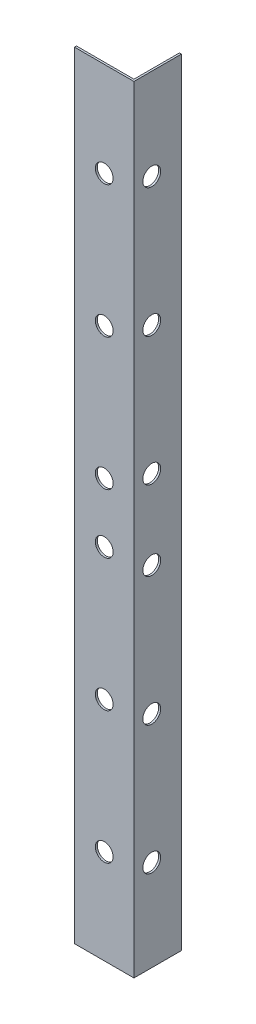
from build123d import *

# Parameters (mm, degrees)
BOSS_EXTRUDE1_DEPTH = 196
CUT_EXTRUDE4_REACH  = 198.939
SKETCH5_R           = 2.25
CUT_EXTRUDE5_REACH  = 198.939
SKETCH6_R           = 2.25


with BuildPart() as part:
    # Sketch1 → Boss-Extrude1 (new body)
    with BuildSketch(Plane(origin=(0, 0, 0), x_dir=(1, 0, 0), z_dir=(0, 1, 0))):
        Polygon((0, 0), (15, 0), (15, 12), (14.5, 12), (14.5, 0.5), (0, 0.5), align=None)
    extrude(amount=BOSS_EXTRUDE1_DEPTH)

    # Sketch5 → Cut-Extrude4 (cut, up to next)
    with BuildSketch(Plane(origin=(15, 0, 0), x_dir=(0, 0, -1), z_dir=(1, 0, 0)), mode=Mode.PRIVATE) as cut_extrude4_sk1:
        with Locations((4.5, 23)):
            Circle(SKETCH5_R)
    cut_extrude4_tool1 = extrude(cut_extrude4_sk1.sketch, amount=-CUT_EXTRUDE4_REACH, mode=Mode.PRIVATE) & part.part
    # Sketch5 → Cut-Extrude4 (cut, up to next)
    with BuildSketch(Plane(origin=(15, 0, 0), x_dir=(0, 0, -1), z_dir=(1, 0, 0)), mode=Mode.PRIVATE) as cut_extrude4_sk2:
        with Locations((4.5, 55.5)):
            Circle(SKETCH5_R)
    cut_extrude4_tool2 = extrude(cut_extrude4_sk2.sketch, amount=-CUT_EXTRUDE4_REACH, mode=Mode.PRIVATE) & part.part
    # Sketch5 → Cut-Extrude4 (cut, up to next)
    with BuildSketch(Plane(origin=(15, 0, 0), x_dir=(0, 0, -1), z_dir=(1, 0, 0)), mode=Mode.PRIVATE) as cut_extrude4_sk3:
        with Locations((4.5, 88)):
            Circle(SKETCH5_R)
    cut_extrude4_tool3 = extrude(cut_extrude4_sk3.sketch, amount=-CUT_EXTRUDE4_REACH, mode=Mode.PRIVATE) & part.part
    # Sketch5 → Cut-Extrude4 (cut, up to next)
    with BuildSketch(Plane(origin=(15, 0, 0), x_dir=(0, 0, -1), z_dir=(1, 0, 0)), mode=Mode.PRIVATE) as cut_extrude4_sk4:
        with Locations((4.5, 108)):
            Circle(SKETCH5_R)
    cut_extrude4_tool4 = extrude(cut_extrude4_sk4.sketch, amount=-CUT_EXTRUDE4_REACH, mode=Mode.PRIVATE) & part.part
    # Sketch5 → Cut-Extrude4 (cut, up to next)
    with BuildSketch(Plane(origin=(15, 0, 0), x_dir=(0, 0, -1), z_dir=(1, 0, 0)), mode=Mode.PRIVATE) as cut_extrude4_sk5:
        with Locations((4.5, 140.5)):
            Circle(SKETCH5_R)
    cut_extrude4_tool5 = extrude(cut_extrude4_sk5.sketch, amount=-CUT_EXTRUDE4_REACH, mode=Mode.PRIVATE) & part.part
    # Sketch5 → Cut-Extrude4 (cut, up to next)
    with BuildSketch(Plane(origin=(15, 0, 0), x_dir=(0, 0, -1), z_dir=(1, 0, 0)), mode=Mode.PRIVATE) as cut_extrude4_sk6:
        with Locations((4.5, 173)):
            Circle(SKETCH5_R)
    cut_extrude4_tool6 = extrude(cut_extrude4_sk6.sketch, amount=-CUT_EXTRUDE4_REACH, mode=Mode.PRIVATE) & part.part
    add(cut_extrude4_tool1.solids().sort_by_distance((15, 23, -4.5))[0], mode=Mode.SUBTRACT)
    add(cut_extrude4_tool2.solids().sort_by_distance((15, 55.5, -4.5))[0], mode=Mode.SUBTRACT)
    add(cut_extrude4_tool3.solids().sort_by_distance((15, 88, -4.5))[0], mode=Mode.SUBTRACT)
    add(cut_extrude4_tool4.solids().sort_by_distance((15, 108, -4.5))[0], mode=Mode.SUBTRACT)
    add(cut_extrude4_tool5.solids().sort_by_distance((15, 140.5, -4.5))[0], mode=Mode.SUBTRACT)
    add(cut_extrude4_tool6.solids().sort_by_distance((15, 173, -4.5))[0], mode=Mode.SUBTRACT)

    # Sketch6 → Cut-Extrude5 (cut, up to next)
    with BuildSketch(Plane.XY, mode=Mode.PRIVATE) as cut_extrude5_sk1:
        with Locations((7.5, 23.833333333)):
            Circle(SKETCH6_R)
    cut_extrude5_tool1 = extrude(cut_extrude5_sk1.sketch, amount=-CUT_EXTRUDE5_REACH, mode=Mode.PRIVATE) & part.part
    # Sketch6 → Cut-Extrude5 (cut, up to next)
    with BuildSketch(Plane.XY, mode=Mode.PRIVATE) as cut_extrude5_sk2:
        with Locations((7.5, 57.166666667)):
            Circle(SKETCH6_R)
    cut_extrude5_tool2 = extrude(cut_extrude5_sk2.sketch, amount=-CUT_EXTRUDE5_REACH, mode=Mode.PRIVATE) & part.part
    # Sketch6 → Cut-Extrude5 (cut, up to next)
    with BuildSketch(Plane.XY, mode=Mode.PRIVATE) as cut_extrude5_sk3:
        with Locations((7.5, 90.5)):
            Circle(SKETCH6_R)
    cut_extrude5_tool3 = extrude(cut_extrude5_sk3.sketch, amount=-CUT_EXTRUDE5_REACH, mode=Mode.PRIVATE) & part.part
    # Sketch6 → Cut-Extrude5 (cut, up to next)
    with BuildSketch(Plane.XY, mode=Mode.PRIVATE) as cut_extrude5_sk4:
        with Locations((7.5, 105.5)):
            Circle(SKETCH6_R)
    cut_extrude5_tool4 = extrude(cut_extrude5_sk4.sketch, amount=-CUT_EXTRUDE5_REACH, mode=Mode.PRIVATE) & part.part
    # Sketch6 → Cut-Extrude5 (cut, up to next)
    with BuildSketch(Plane.XY, mode=Mode.PRIVATE) as cut_extrude5_sk5:
        with Locations((7.5, 138.833333333)):
            Circle(SKETCH6_R)
    cut_extrude5_tool5 = extrude(cut_extrude5_sk5.sketch, amount=-CUT_EXTRUDE5_REACH, mode=Mode.PRIVATE) & part.part
    # Sketch6 → Cut-Extrude5 (cut, up to next)
    with BuildSketch(Plane.XY, mode=Mode.PRIVATE) as cut_extrude5_sk6:
        with Locations((7.5, 172.166666667)):
            Circle(SKETCH6_R)
    cut_extrude5_tool6 = extrude(cut_extrude5_sk6.sketch, amount=-CUT_EXTRUDE5_REACH, mode=Mode.PRIVATE) & part.part
    add(cut_extrude5_tool1.solids().sort_by_distance((7.5, 23.833333, 0))[0], mode=Mode.SUBTRACT)
    add(cut_extrude5_tool2.solids().sort_by_distance((7.5, 57.166667, 0))[0], mode=Mode.SUBTRACT)
    add(cut_extrude5_tool3.solids().sort_by_distance((7.5, 90.5, 0))[0], mode=Mode.SUBTRACT)
    add(cut_extrude5_tool4.solids().sort_by_distance((7.5, 105.5, 0))[0], mode=Mode.SUBTRACT)
    add(cut_extrude5_tool5.solids().sort_by_distance((7.5, 138.833333, 0))[0], mode=Mode.SUBTRACT)
    add(cut_extrude5_tool6.solids().sort_by_distance((7.5, 172.166667, 0))[0], mode=Mode.SUBTRACT)


solid = part.part
